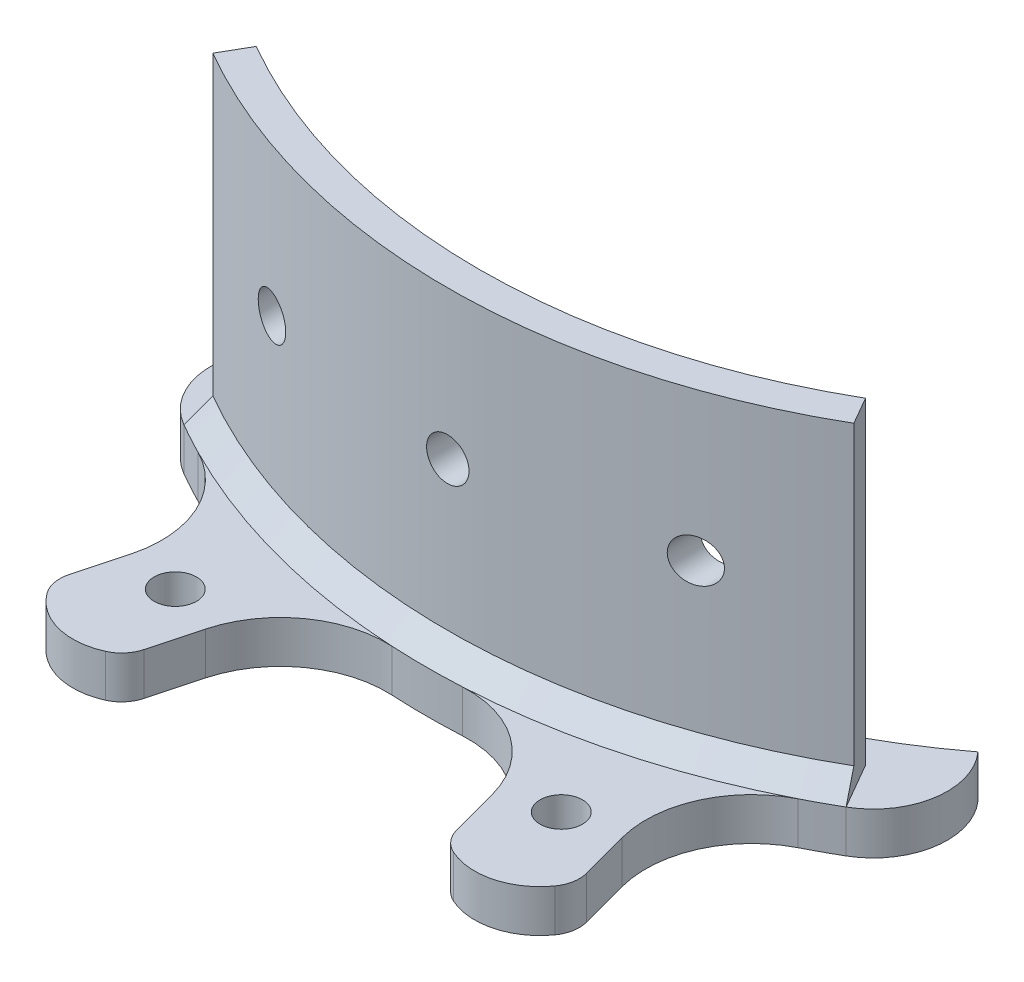
from build123d import *

# Parameters (mm, degrees)
BOSS_EXTRUDE1_DEPTH     = 10
BOSS_EXTRUDE2_DEPTH     = 30
BOSS_EXTRUDE3_DEPTH     = 4
CHAMFER1_SIZE           = 2
CUT_EXTRUDE1_DEPTH      = 78.548774974
CUT_EXTRUDE1_DEPTH_BACK = 78.548774974
SKETCH5_R               = 2
BOSS_EXTRUDE4_START     = -4
SKETCH6_R               = 2
BOSS_EXTRUDE4_DEPTH     = 4
FILLET1_R               = 10
CUT_EXTRUDE2_DEPTH      = 90.553145411
CUT_EXTRUDE2_DEPTH_BACK = 90.553145411
SKETCH7_R               = 54.5


with BuildPart() as part:
    # Sketch1 → Boss-Extrude1 (new body)
    with BuildSketch(Plane(origin=(0, 0, 0), x_dir=(1, 0, 0), z_dir=(0, 1, 0))):
        with BuildLine():
            ThreePointArc((-25.25, -43.734282891), (0, -50.5), (25.25, -43.734282891))
            Line((25.25, -43.734282891), (27.25, -47.198384506))
            ThreePointArc((27.25, -47.198384506), (0, -54.5), (-27.25, -47.198384506))
            Line((-27.25, -47.198384506), (-25.25, -43.734282891))
        make_face()
    extrude(amount=BOSS_EXTRUDE1_DEPTH)



with BuildPart() as body_2:
    # Sketch3 → Boss-Extrude2 (new body)
    with BuildSketch(Plane.XZ):
        with BuildLine():
            Line((-30.25, 52.394536929), (-28.75, 49.796460718))
            ThreePointArc((-28.75, 49.796460718), (0, 57.5), (28.75, 49.796460718))
            Line((28.75, 49.796460718), (30.25, 52.394536929))
            ThreePointArc((30.25, 52.394536929), (0, 60.5), (-30.25, 52.394536929))
        make_face()
    extrude(amount=-BOSS_EXTRUDE2_DEPTH)


with BuildPart() as part_1:
    add(part.part)

    add(body_2.part)  # Boss-Extrude3 merges body 2
    # Sketch4 → Boss-Extrude3 (add)
    with BuildSketch(Plane.XZ):
        with BuildLine():
            ThreePointArc((-24.25, 42.002232084), (0, 48.5), (24.25, 42.002232084))
            ThreePointArc((24.25, 42.002232084), (33.812177826, 44.56440991), (31.25, 54.126587737))
            ThreePointArc((31.25, 54.126587737), (0, 62.5), (-31.25, 54.126587737))
            ThreePointArc((-31.25, 54.126587737), (-33.812177826, 44.56440991), (-24.25, 42.002232084))
        make_face()
    extrude(amount=BOSS_EXTRUDE3_DEPTH)

    # Chamfer1
    chamfer1_edges = [part_1.edges().sort_by_distance(p)[0] for p in [
        (0, 0, 60.5),
        (0, 0, 50.5),
    ]]
    chamfer(chamfer1_edges, length=CHAMFER1_SIZE - 0.0001)  # a hair under: the kernel refuses the full size

    # Sketch5 → Cut-Extrude1 (cut, two sides: drawn at the far end of the back side and taken through both)
    with BuildSketch(Plane.XY.offset(-CUT_EXTRUDE1_DEPTH_BACK)):
        with Locations(Location((0, 16, 0), (0, 0, 180))):
            Circle(SKETCH5_R)
        with Locations(Location((-20, 16, 0), (0, 0, 180))):
            Circle(SKETCH5_R)
        with Locations(Location((20, 16, 0), (0, 0, 180))):
            Circle(SKETCH5_R)
    extrude(amount=CUT_EXTRUDE1_DEPTH + CUT_EXTRUDE1_DEPTH_BACK, mode=Mode.SUBTRACT)

    # Sketch6 → Boss-Extrude4 (add)
    # profile 1 of 2: a face of its own
    with BuildSketch(Plane.XZ.offset(4).offset(BOSS_EXTRUDE4_START)):
        with BuildLine():
            Line((20.953972553, 58.882773663), (24.414654978, 71.798216302))
            ThreePointArc((24.414654978, 71.798216302), (24.468385119, 73.111891055), (23.955219754, 74.322382523))
            ThreePointArc((23.955219754, 74.322382523), (20.546663808, 76.681193258), (16.415362401, 76.342681212))
            ThreePointArc((16.415362401, 76.342681212), (15.365702425, 75.550947532), (14.755396715, 74.386406753))
            Line((14.755396715, 74.386406753), (11.29471429, 61.470964114))
            ThreePointArc((11.29471429, 61.470964114), (16.176190319, 60.370364143), (20.953972553, 58.882773663))
        make_face()
        with Locations(Location((18.213190451, 67.972552131, 0), (0, 0, 270))):
            Circle(SKETCH6_R, mode=Mode.SUBTRACT)
    # profile 2 of 2: a face of its own
    with BuildSketch(Plane.XZ.offset(4).offset(BOSS_EXTRUDE4_START)):
        with BuildLine():
            Line((-20.953972553, 58.882773663), (-24.414654978, 71.798216302))
            ThreePointArc((-24.414654978, 71.798216302), (-24.468385119, 73.111891055), (-23.955219754, 74.322382523))
            ThreePointArc((-23.955219754, 74.322382523), (-20.546663808, 76.681193258), (-16.415362401, 76.342681212))
            ThreePointArc((-16.415362401, 76.342681212), (-15.365702425, 75.550947532), (-14.755396715, 74.386406753))
            Line((-14.755396715, 74.386406753), (-11.29471429, 61.470964114))
            ThreePointArc((-11.29471429, 61.470964114), (-16.176190319, 60.370364143), (-20.953972553, 58.882773663))
        make_face()
        with Locations(Location((-18.213190451, 67.972552131, 0), (0, 0, 270))):
            Circle(SKETCH6_R, mode=Mode.SUBTRACT)
    extrude(amount=BOSS_EXTRUDE4_DEPTH)

    # Fillet1
    fillet1_edges = [part_1.edges().sort_by_distance(p)[0] for p in [
        (-11.29471429, -2, 61.470964114),
        (-20.953972553, -2, 58.882773663),
        (20.953972553, -2, 58.882773663),
        (11.29471429, -2, 61.470964114),
    ]]
    fillet(fillet1_edges, radius=FILLET1_R)

    # Sketch7 → Cut-Extrude2 (cut, two sides: drawn at the far end of the back side and taken through both)
    with BuildSketch(Plane(origin=(0, 0, 0), x_dir=(1, 0, 0), z_dir=(0, 1, 0)).offset(-CUT_EXTRUDE2_DEPTH_BACK)):
        Circle(SKETCH7_R)
    extrude(amount=CUT_EXTRUDE2_DEPTH + CUT_EXTRUDE2_DEPTH_BACK, mode=Mode.SUBTRACT)


solid = part_1.part
